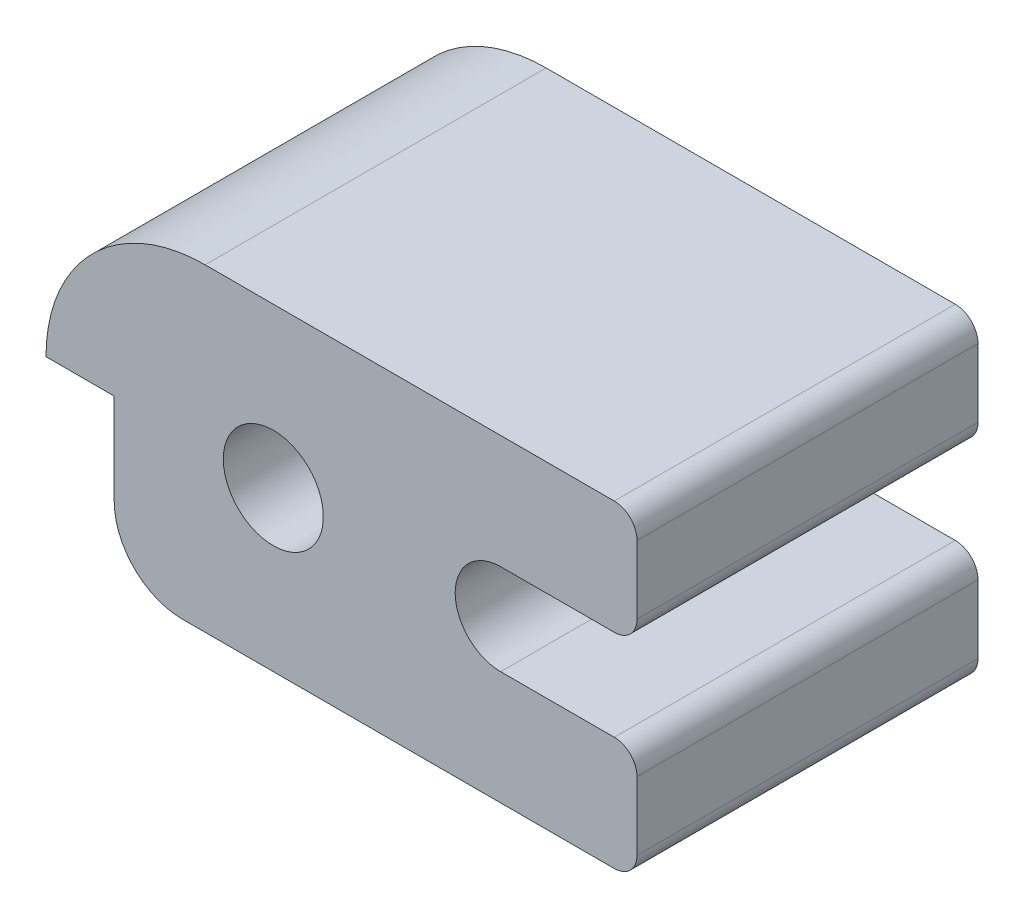
from build123d import *

# Parameters (mm, degrees)
SKETCH1_R           = 2.794
BOSS_EXTRUDE1_DEPTH = 19.05
FILLET2_R           = 8.89
FRONT_FILLET_R      = 1.27
FILLET3_R           = 3.81


with BuildPart() as part:
    # Sketch1 → Boss-Extrude1 (new body)
    with BuildSketch(Plane.XY):
        with BuildLine():
            Line((-12.7, 0), (-8.89, 0))
            Line((-8.89, 0), (-8.89, -8.89))
            Line((-8.89, -8.89), (20.32, -8.89))
            Line((20.32, -8.89), (20.32, -2.54))
            Line((20.32, -2.54), (12.7, -2.54))
            ThreePointArc((12.7, -2.54), (10.16, 0), (12.7, 2.54))
            Line((12.7, 2.54), (20.32, 2.54))
            Line((20.32, 2.54), (20.32, 8.89))
            Line((20.32, 8.89), (-12.7, 8.89))
            Line((-12.7, 8.89), (-12.7, 0))
        make_face()
        with Locations(Location((0, 0, 0), (0, 0, 180))):
            Circle(SKETCH1_R, mode=Mode.SUBTRACT)
    extrude(amount=BOSS_EXTRUDE1_DEPTH)

    # Fillet2
    fillet2_edges = [part.edges().sort_by_distance(p)[0] for p in [
        (-12.7, 8.89, 9.525),
    ]]
    fillet(fillet2_edges, radius=FILLET2_R - 0.0001)  # a hair under: the kernel refuses the full size

    # front_fillet
    front_fillet_edges = [part.edges().sort_by_distance(p)[0] for p in [
        (20.32, -8.89, 9.525),
        (20.32, 8.89, 9.525),
        (20.32, 2.54, 9.525),
        (20.32, -2.54, 9.525),
    ]]
    fillet(front_fillet_edges, radius=FRONT_FILLET_R)

    # Fillet3
    fillet3_edges = [part.edges().sort_by_distance(p)[0] for p in [
        (-8.89, -8.89, 9.525),
    ]]
    fillet(fillet3_edges, radius=FILLET3_R)


solid = part.part
